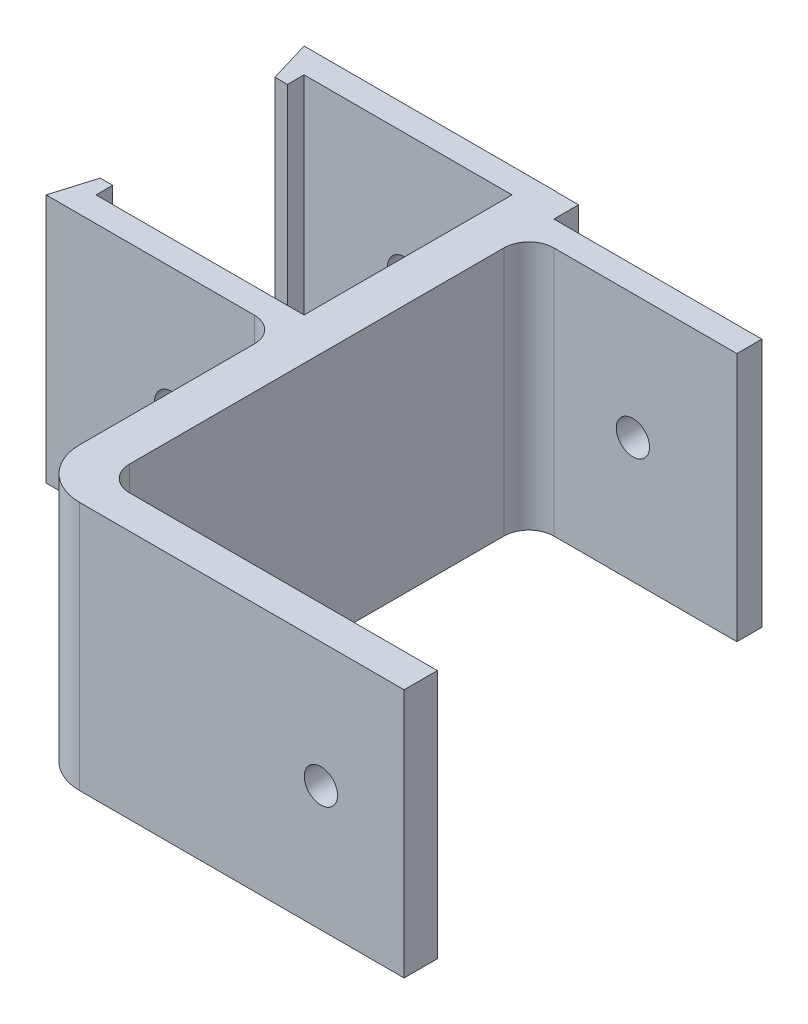
from build123d import *

# Parameters (mm, degrees)
EXTRUDE_1_DEPTH      = 110
CUT_EXTRUDE_4_DEPTH  = 134.373777696
SKETCH_7_W           = 16.60831278
SKETCH_7_H           = 38.473598513
CUT_EXTRUDE_14_DEPTH = 134.373777696
SKETCH_8_W           = 5
SKETCH_8_H           = 30.968526609
EXTRUDE_2_DEPTH      = 110
SKETCH_10_W          = 5
SKETCH_10_H          = 26
EXTRUDE_4_DEPTH      = 110
SKETCH_16_W          = 45
SKETCH_16_H          = 4
EXTRUDE_7_DEPTH      = 110
FILLET_4_R           = 3
FILLET_5_R           = 6
SKETCH_18_W          = 113.67218818
SKETCH_18_H          = 61.649849458
CUT_EXTRUDE_18_DEPTH = 137.586229955
SKETCH_19_R          = 2.1
SKETCH_19_R_2        = 2
CUT_EXTRUDE_19_DEPTH = 143.431323365
SKETCH_22_W          = 25
SKETCH_22_H          = 3
EXTRUDE_10_DEPTH     = 30
FILLET_7_R           = 3
SKETCH_23_R          = 2
CUT_EXTRUDE_24_DEPTH = 10
SKETCH_24_W          = 79.129869038
SKETCH_24_H          = 20.357001259
CUT_EXTRUDE_25_DEPTH = 143.431323365


# Read off the part's stored shape, not the designer's step: Бобышка-Вытянуть1
with BuildPart() as part:
    # Бобышка-Вытянуть1 outline → Бобышка-Вытянуть1 (new body)
    with BuildSketch(Plane(origin=(0, 0, 0), x_dir=(1, 0, 0), z_dir=(0, 1, 0))):
        Polygon((-36.579007505, 34.969739794), (-66.825757576, 34.969739794), (-66.825757576, 29.969739794), (-63.825757576, 29.969739794), (-63.825757576, 31.969739794), (-38.825757576, 31.969739794), (-38.825757576, 6.969739794), (-63.825757576, 6.969739794), (-63.825757576, 8.969739794), (-66.825757576, 8.969739794), (-66.825757576, 3.969739794), (-22.123470102, 3.969739794), align=None)
    extrude(amount=EXTRUDE_1_DEPTH)

    # Эскиз3 → Вырез-Вытянуть4 (cut, through all)
    with BuildSketch(Plane.XZ):
        Polygon((-66.825757576, -3.969739794), (-65.325757576, -8.969739794), (-66.825757576, -8.969739794), align=None)
        Polygon((-66.825757576, -29.969739794), (-66.825757576, -34.969739794), (-65.325757576, -29.969739794), align=None)
    extrude(amount=-CUT_EXTRUDE_4_DEPTH, mode=Mode.SUBTRACT)

    # Эскиз7 → Вырез-Вытянуть14 (cut, through all)
    with BuildSketch(Plane(origin=(0, 0, 0), x_dir=(-1, 0, 0), z_dir=(0, -1, 0))):
        with Locations((27.703474463, 20.539743139)):
            Rectangle(SKETCH_7_W, SKETCH_7_H)
    extrude(amount=-CUT_EXTRUDE_14_DEPTH, mode=Mode.SUBTRACT)

    # Эскиз8 → Бобышка-Вытянуть2 (add)
    with BuildSketch(Plane(origin=(0, 0, 0), x_dir=(-1, 0, 0), z_dir=(0, -1, 0))):
        with Locations((36.298943925, 19.454003098)):
            Rectangle(SKETCH_8_W, SKETCH_8_H)
    extrude(amount=-EXTRUDE_2_DEPTH)

    # Эскиз10 → Бобышка-Вытянуть4 (add)
    with BuildSketch(Plane.XZ):
        with Locations((-36.298943925, 9.030260206)):
            Rectangle(SKETCH_10_W, SKETCH_10_H)
    extrude(amount=-EXTRUDE_4_DEPTH)

    # Эскиз16 → Бобышка-Вытянуть7 (add, through all)
    with BuildSketch(Plane(origin=(0, 110, 0), x_dir=(1, 0, 0), z_dir=(0, 1, 0))):
        with Locations((-16.298943925, -24.030260206)):
            Rectangle(SKETCH_16_W, SKETCH_16_H)
    extrude(amount=-EXTRUDE_7_DEPTH)

    # Скругление4
    fillet_4_edges = [part.edges().sort_by_distance(p)[0] for p in [
        (-38.798943925, 55, -3.969739794),
        (-33.798943925, 55, 22.030260206),
    ]]
    fillet(fillet_4_edges, radius=FILLET_4_R)

    # Скругление5
    fillet_5_edges = [part.edges().sort_by_distance(p)[0] for p in [
        (-38.798943925, 55, 26.030260206),
    ]]
    fillet(fillet_5_edges, radius=FILLET_5_R)

    # Эскиз18 → Вырез-Вытянуть18 (cut, through all)
    with BuildSketch(Plane(origin=(6.201056075, 0, 0), x_dir=(0, 0, -1), z_dir=(1, 0, 0))):
        with Locations((3.709673157, 49.175075271)):
            Rectangle(SKETCH_18_W, SKETCH_18_H)
    extrude(amount=-CUT_EXTRUDE_18_DEPTH, mode=Mode.SUBTRACT)


with BuildPart() as cut_extrude_18_piece_1:
    # of the separate pieces the step leaves, piece 1, a body of its own (cut_extrude_18_pieces)
    add(part.part.solids().sort_by_distance((-38.798943925, 110, 20.030260206))[0])

    # Эскиз19 → Вырез-Вытянуть19 (cut, through all)
    with BuildSketch(Plane(origin=(0, 0, -34.969739794), x_dir=(-1, 0, 0), z_dir=(0, 0, -1))):
        with Locations((51.70238254, 95)):
            Circle(SKETCH_19_R)
        with Locations((3.798943925, 95)):
            Circle(SKETCH_19_R_2)
    extrude(amount=-CUT_EXTRUDE_19_DEPTH, mode=Mode.SUBTRACT)

    # Эскиз22 → Бобышка-Вытянуть10 (add)
    with BuildSketch(Plane.XZ.offset(-80)):
        with Locations((-21.298943925, -30.469739794)):
            Rectangle(SKETCH_22_W, SKETCH_22_H)
    extrude(amount=-EXTRUDE_10_DEPTH)

    # Скругление7
    fillet_7_edges = [cut_extrude_18_piece_1.edges().sort_by_distance(p)[0] for p in [
        (-33.798943925, 95, -28.969739794),
    ]]
    fillet(fillet_7_edges, radius=FILLET_7_R)

    # Эскиз23 → Вырез-Вытянуть24 (cut)
    with BuildSketch(Plane(origin=(0, 0, -31.969739794), x_dir=(-1, 0, 0), z_dir=(0, 0, -1))):
        with Locations((21.298943925, 95)):
            Circle(SKETCH_23_R)
    extrude(amount=-CUT_EXTRUDE_24_DEPTH, mode=Mode.SUBTRACT)


with BuildPart() as cut_extrude_18_piece_2:
    # of the separate pieces the step leaves, piece 2, a body of its own (cut_extrude_18_pieces)
    add(part.part.solids().sort_by_distance((-38.798943925, 18.350150542, -0.969739794))[0])

    # Эскиз24 → Вырез-Вытянуть25 (cut, through all)
    with BuildSketch(Plane(origin=(0, 0, -34.969739794), x_dir=(-1, 0, 0), z_dir=(0, 0, -1))):
        with Locations((27.260823057, 8.171649913)):
            Rectangle(SKETCH_24_W, SKETCH_24_H)
    extrude(amount=-CUT_EXTRUDE_25_DEPTH, mode=Mode.SUBTRACT)


solid = cut_extrude_18_piece_1.part
